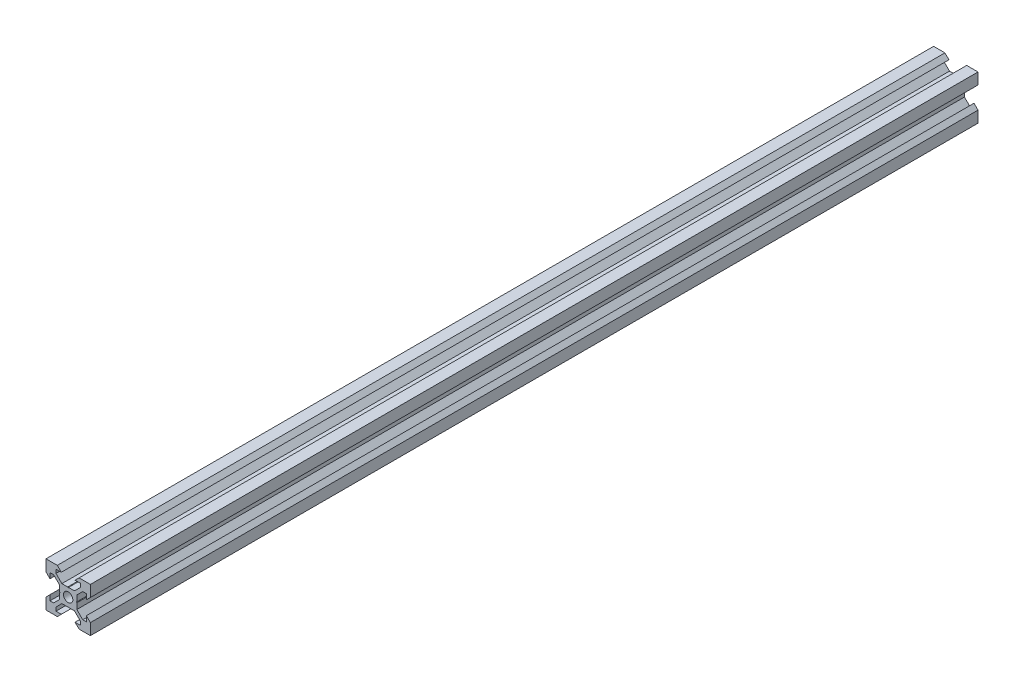
from build123d import *

# Parameters (mm, degrees)
SKETCH1_R           = 2.1
BOSS_EXTRUDE1_DEPTH = 400
CUT_EXTRUDE1_DEPTH  = 400


# Read off the part's stored shape, not the designer's step: Cut-Extrude1
with BuildPart() as part:
    # Sketch1 → Boss-Extrude1 (new body)
    with BuildSketch(Plane.XY):
        Polygon((-10, -4.9), (-10, -10), (-4.9, -10), (-3.1, -8.2), (-5.499339828, -8.2), (-5.499339828, -6.56), (-2.84, -3.900660172), (2.84, -3.900660172), (5.499339828, -6.56), (5.499339828, -8.2), (3.1, -8.2), (4.9, -10), (10, -10), (10, -4.9), (8.2, -3.1), (8.2, -5.499339828), (6.56, -5.499339828), (3.900660172, -2.84), (3.900660172, 2.84), (6.56, 5.499339828), (8.2, 5.499339828), (8.2, 3.1), (10, 4.9), (10, 10), (4.9, 10), (3.1, 8.2), (5.499339828, 8.2), (5.499339828, 6.56), (2.84, 3.900660172), (-2.84, 3.900660172), (-5.499339828, 6.56), (-5.499339828, 8.2), (-3.1, 8.2), (-4.9, 10), (-10, 10), (-10, 4.9), (-8.2, 3.1), (-8.2, 5.499339828), (-6.56, 5.499339828), (-3.900660172, 2.84), (-3.900660172, -2.84), (-6.56, -5.499339828), (-8.2, -5.499339828), (-8.2, -3.1), align=None)
        Circle(SKETCH1_R, mode=Mode.SUBTRACT)
    extrude(amount=BOSS_EXTRUDE1_DEPTH)

    # Cut-Extrude1 outline → Cut-Extrude1 (cut)
    with BuildSketch(Plane.XY):
        with BuildLine():
            ThreePointArc((-3.900660172, -0.2), (-3.700660172, 0), (-3.900660172, 0.2))
            Line((-3.900660172, 0.2), (-3.900660172, -0.2))
        make_face()
        with BuildLine():
            ThreePointArc((-0.2, 3.900660172), (0, 3.700660172), (0.2, 3.900660172))
            Line((0.2, 3.900660172), (-0.2, 3.900660172))
        make_face()
        with BuildLine():
            ThreePointArc((3.900660172, 0.2), (3.700660172, 0), (3.900660172, -0.2))
            Line((3.900660172, -0.2), (3.900660172, 0.2))
        make_face()
        with BuildLine():
            ThreePointArc((0.2, -3.900660172), (0, -3.700660172), (-0.2, -3.900660172))
            Line((-0.2, -3.900660172), (0.2, -3.900660172))
        make_face()
    extrude(amount=CUT_EXTRUDE1_DEPTH, mode=Mode.SUBTRACT)


solid = part.part
